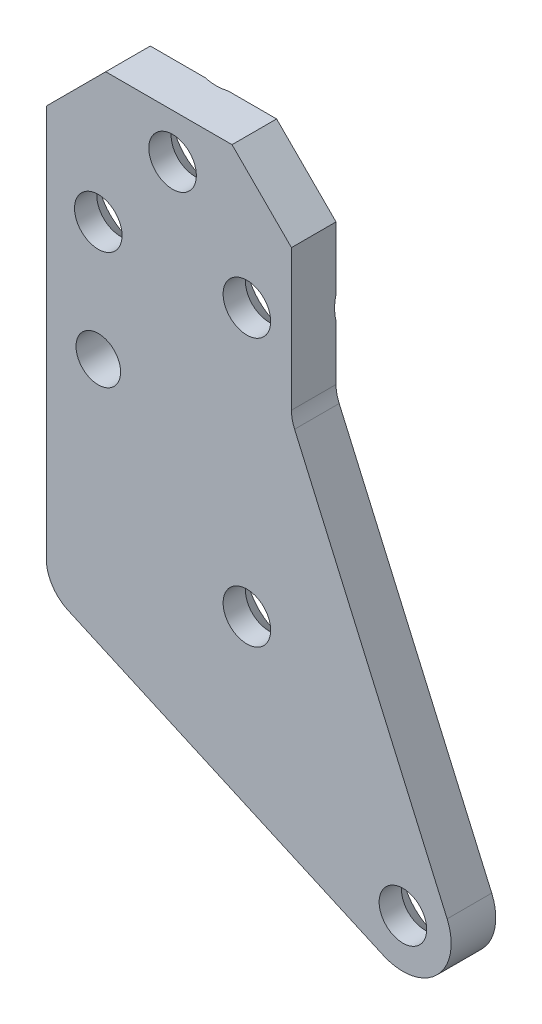
from build123d import *

# Parameters (mm, degrees)
SKETCH_1_R      = 1.5
SKETCH_1_R_2    = 1.6
EXTRUDE_1_DEPTH = 1.5
CHAMFER_1_SIZE  = 1.5
FILLET_1_R      = 2.5
CHAMFER_2_SIZE  = 4


with BuildPart() as part:
    # 草图1 → 凸台-拉伸1 (new, symmetric)
    with BuildSketch(Plane.XY):
        with BuildLine():
            Line((-3.5, 17), (-3.5, -15))
            Line((-3.5, -15), (19.171710101, -25.152700357))
            ThreePointArc((19.171710101, -25.152700357), (22.789314225, -24.493379894), (23.476214014, -20.880910968))
            Line((23.476214014, -20.880910968), (13, 3))
            Line((13, 3), (13, 17))
            Line((13, 17), (-3.5, 17))
        make_face()
        Circle(SKETCH_1_R, mode=Mode.SUBTRACT)
        with Locations((10, -10)):
            Circle(SKETCH_1_R_2, mode=Mode.SUBTRACT)
        with Locations((20.5, -22.186533479)):
            Circle(SKETCH_1_R_2, mode=Mode.SUBTRACT)
        with Locations((0, 8)):
            Circle(SKETCH_1_R_2, mode=Mode.SUBTRACT)
        with Locations((10, 8)):
            Circle(SKETCH_1_R_2, mode=Mode.SUBTRACT)
        with Locations((5, 14)):
            Circle(SKETCH_1_R_2, mode=Mode.SUBTRACT)
    extrude(amount=EXTRUDE_1_DEPTH, both=True)

    # 倒角1
    # the kernel refuses this chamfer: 1.5 mm, written as the material it takes off along each edge
    with BuildSketch(Plane(origin=(10, -10, -1.5), x_dir=(1, 0, 0), z_dir=(0, -1, 0))) as chamfer_1_piece_1:
        Polygon((1.6, CHAMFER_1_SIZE), (1.6 + CHAMFER_1_SIZE, 0), (1.6, 0), align=None)
    revolve(axis=Axis((10, -10, -1.5), (0, 0, 1)), mode=Mode.SUBTRACT)
    with BuildSketch(Plane(origin=(20.5, -22.186533479, -1.5), x_dir=(1, 0, 0), z_dir=(0, -1, 0))) as chamfer_1_piece_2:
        Polygon((1.6, CHAMFER_1_SIZE), (1.6 + CHAMFER_1_SIZE, 0), (1.6, 0), align=None)
    revolve(axis=Axis((20.5, -22.186533479, -1.5), (0, 0, 1)), mode=Mode.SUBTRACT)
    with BuildSketch(Plane(origin=(0, 8, -1.5), x_dir=(1, 0, 0), z_dir=(0, -1, 0))) as chamfer_1_piece_3:
        Polygon((1.6, CHAMFER_1_SIZE), (1.6 + CHAMFER_1_SIZE, 0), (1.6, 0), align=None)
    revolve(axis=Axis((0, 8, -1.5), (0, 0, 1)), mode=Mode.SUBTRACT)
    with BuildSketch(Plane(origin=(10, 8, -1.5), x_dir=(1, 0, 0), z_dir=(0, -1, 0))) as chamfer_1_piece_4:
        Polygon((1.6, CHAMFER_1_SIZE), (1.6 + CHAMFER_1_SIZE, 0), (1.6, 0), align=None)
    revolve(axis=Axis((10, 8, -1.5), (0, 0, 1)), mode=Mode.SUBTRACT)
    with BuildSketch(Plane(origin=(5, 14, -1.5), x_dir=(1, 0, 0), z_dir=(0, -1, 0))) as chamfer_1_piece_5:
        Polygon((1.6, CHAMFER_1_SIZE), (1.6 + CHAMFER_1_SIZE, 0), (1.6, 0), align=None)
    revolve(axis=Axis((5, 14, -1.5), (0, 0, 1)), mode=Mode.SUBTRACT)

    # 圆角1
    fillet_1_edges = [part.edges().sort_by_distance(p)[0] for p in [
        (13, 3, 0),
        (-3.5, -15, 0),
    ]]
    fillet(fillet_1_edges, radius=FILLET_1_R)

    # 倒角2
    chamfer_2_edges = [part.edges().sort_by_distance(p)[0] for p in [
        (13, 17, 0),
        (-3.5, 17, 0),
    ]]
    chamfer(chamfer_2_edges, length=CHAMFER_2_SIZE)


solid = part.part
